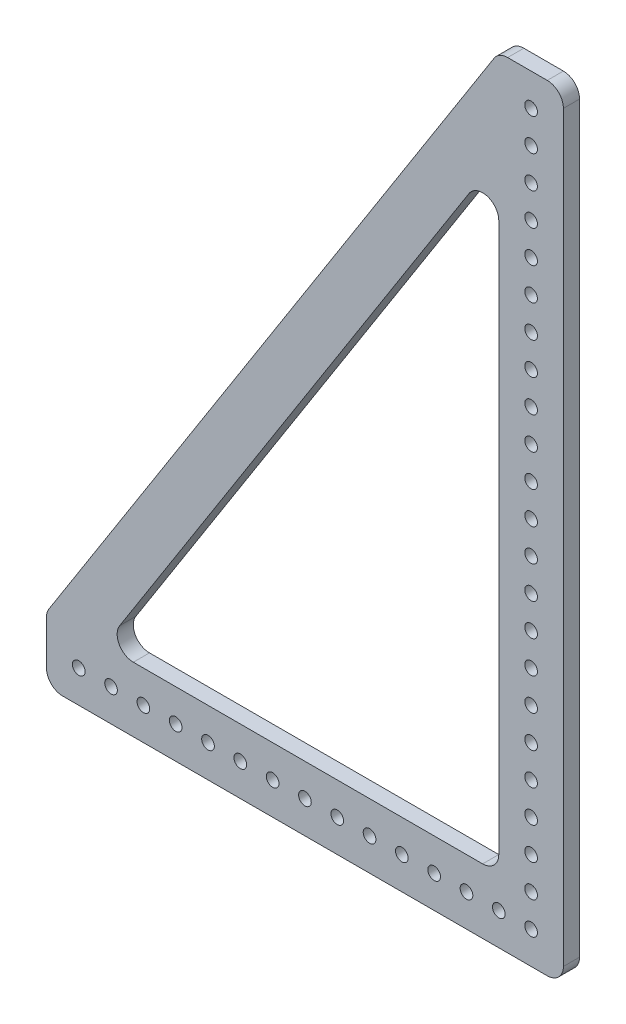
from build123d import *

# Parameters (mm, degrees)
BOSS_EXTRUDE1_DEPTH = 6.35
SKETCH2_R           = 2.4892
CUT_EXTRUDE1_DEPTH  = 367.379042113
FILLET1_R           = 6.35


with BuildPart() as part:
    # Sketch1 → Boss-Extrude1 (new body)
    with BuildSketch(Plane.XY):
        Polygon((0, 25.4), (177.8, 304.8), (203.2, 304.8), (203.2, 0), (0, 0), align=None)
    extrude(amount=BOSS_EXTRUDE1_DEPTH)

    # Sketch2 → Cut-Extrude1 (cut, through all)
    with BuildSketch(Plane.XY.offset(6.35)):
        with Locations((190.5, 12.7)):
            Circle(SKETCH2_R)
        with Locations((177.8, 12.7)):
            Circle(SKETCH2_R)
        with Locations((165.1, 12.7)):
            Circle(SKETCH2_R)
        with Locations((152.4, 12.7)):
            Circle(SKETCH2_R)
        with Locations((139.7, 12.7)):
            Circle(SKETCH2_R)
        with Locations((127, 12.7)):
            Circle(SKETCH2_R)
        with Locations((114.3, 12.7)):
            Circle(SKETCH2_R)
        with Locations((190.5, 25.4)):
            Circle(SKETCH2_R)
        with Locations((190.5, 38.1)):
            Circle(SKETCH2_R)
        with Locations((190.5, 50.8)):
            Circle(SKETCH2_R)
        with Locations((190.5, 63.5)):
            Circle(SKETCH2_R)
        with Locations((190.5, 76.2)):
            Circle(SKETCH2_R)
        with Locations((190.5, 88.9)):
            Circle(SKETCH2_R)
        with Locations((190.5, 101.6)):
            Circle(SKETCH2_R)
        with Locations((190.5, 114.3)):
            Circle(SKETCH2_R)
        with Locations((190.5, 127)):
            Circle(SKETCH2_R)
        with Locations((190.5, 139.7)):
            Circle(SKETCH2_R)
        with Locations((190.5, 152.4)):
            Circle(SKETCH2_R)
        with Locations((190.5, 165.1)):
            Circle(SKETCH2_R)
        with Locations((190.5, 177.8)):
            Circle(SKETCH2_R)
        with Locations((190.5, 190.5)):
            Circle(SKETCH2_R)
        with Locations((190.5, 203.2)):
            Circle(SKETCH2_R)
        with Locations((190.5, 215.9)):
            Circle(SKETCH2_R)
        with Locations((190.5, 228.6)):
            Circle(SKETCH2_R)
        with Locations((190.5, 241.3)):
            Circle(SKETCH2_R)
        with Locations((190.5, 254)):
            Circle(SKETCH2_R)
        with Locations((190.5, 266.7)):
            Circle(SKETCH2_R)
        with Locations((190.5, 279.4)):
            Circle(SKETCH2_R)
        with Locations((190.5, 292.1)):
            Circle(SKETCH2_R)
        with Locations((101.6, 12.7)):
            Circle(SKETCH2_R)
        with Locations((88.9, 12.7)):
            Circle(SKETCH2_R)
        with Locations((76.2, 12.7)):
            Circle(SKETCH2_R)
        with Locations((63.5, 12.7)):
            Circle(SKETCH2_R)
        with Locations((50.8, 12.7)):
            Circle(SKETCH2_R)
        with Locations((38.1, 12.7)):
            Circle(SKETCH2_R)
        with Locations((25.4, 12.7)):
            Circle(SKETCH2_R)
        with Locations((12.7, 12.7)):
            Circle(SKETCH2_R)
        Polygon((22.580146513, 25.4), (177.8, 25.4), (177.8, 269.316912623), align=None)
    extrude(amount=-CUT_EXTRUDE1_DEPTH, mode=Mode.SUBTRACT)

    # Fillet1
    fillet1_edges = [part.edges().sort_by_distance(p)[0] for p in [
        (203.2, 0, 3.175),
        (0, 25.4, 3.175),
        (177.8, 304.8, 3.175),
        (203.2, 304.8, 3.175),
        (0, 0, 3.175),
        (177.8, 25.4, 3.175),
        (177.8, 269.316912623, 3.175),
        (22.580146513, 25.4, 3.175),
    ]]
    fillet(fillet1_edges, radius=FILLET1_R)


solid = part.part
